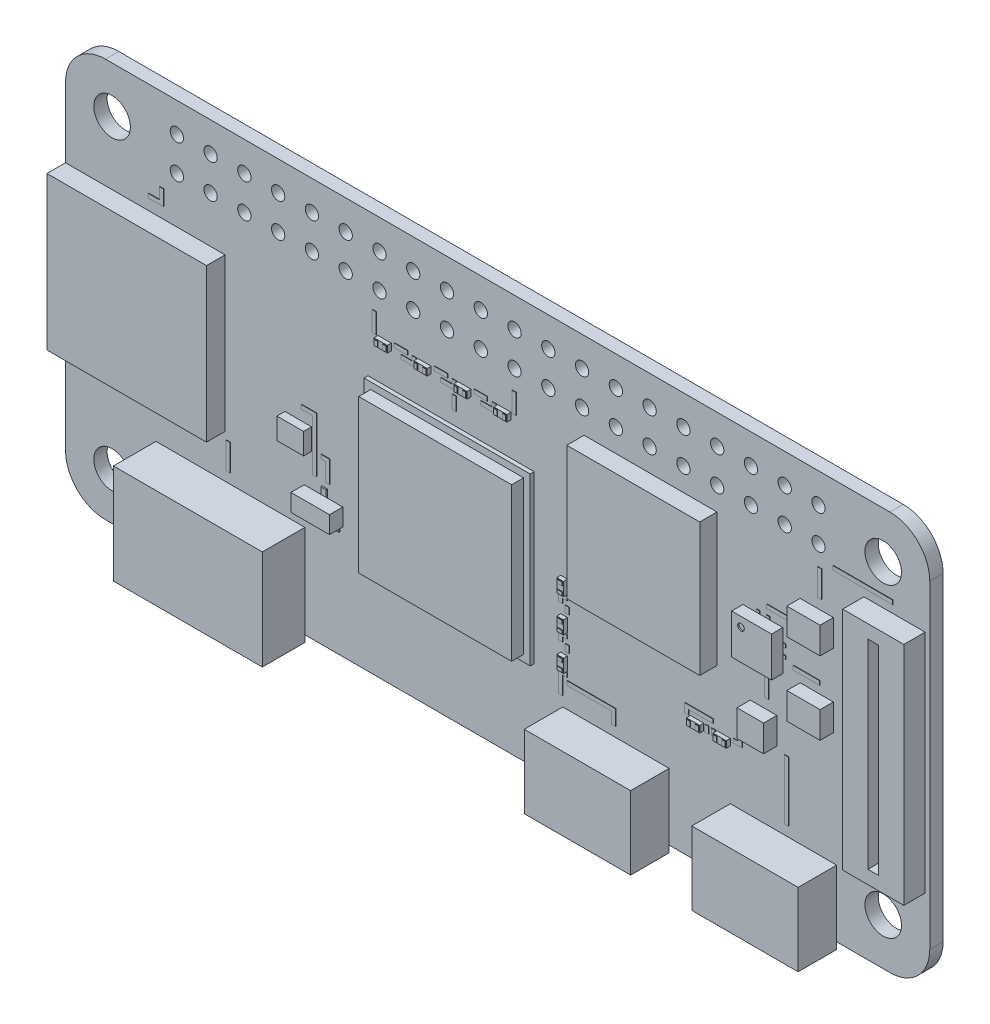
from build123d import *

# Parameters (mm, degrees)
PCB_DEPTH       = 1
SKETCH2_W       = 0.3
SKETCH2_H       = 1
SKETCH2_H_2     = 2
SKETCH2_H_3     = 4.5
SKETCH2_W_2     = 4.5
SKETCH2_H_4     = 0.3
SKETCH2_W_3     = 2
SKETCH2_H_5     = 1.5
SKETCH2_H_6     = 0.5
SKETCH2_W_4     = 0.5
SKETCH2_W_5     = 1
TRACKS_DEPTH    = 0.035
SKETCH3_W       = 0.25
SKETCH3_H       = 0.3
SKETCH3_W_2     = 0.3
SKETCH3_H_2     = 0.25
SMD_ADD00_DEPTH = 0.05
SKETCH4_W       = 0.4
SKETCH4_H       = 0.7
SMD_ADD01_DEPTH = 0.1
SKETCH5_W       = 12.5
SKETCH5_H       = 12.5
SKETCH5_W_2     = 0.5
SKETCH5_H_2     = 1
SKETCH5_W_3     = 1
SKETCH5_H_3     = 0.5
SMD_ADD02_DEPTH = 0.3
SKETCH6_W       = 2
SKETCH6_H       = 1.6
SMD_ADD03_DEPTH = 0.6
SKETCH7_W       = 2.5
SKETCH7_H       = 2
SKETCH7_W_2     = 2
SMD_ADD04_DEPTH = 1
SKETCH8_W       = 10
SKETCH8_H       = 10
SMD_ADD05_DEPTH = 1.3
SKETCH9_W       = 12
SKETCH9_H       = 11.5
SMD_ADD06_DEPTH = 1.4
SKETCH10_W      = 4.6
SKETCH10_H      = 17
SMD_ADD07_DEPTH = 1.6
SKETCH11_W      = 8
SKETCH11_H      = 5.5
SMD_ADD08_DEPTH = 2.9
SKETCH12_W      = 11.2
SKETCH12_H      = 7.5
SMD_ADD09_DEPTH = 3.2
SKETCH13_W      = 3
SKETCH13_H      = 3
SMD_ADD10_DEPTH = 0.85
SKETCH14_W      = 2.9
SKETCH14_H      = 1.3
SMD_ADD11_DEPTH = 1
SKETCH15_W      = 0.4
SKETCH15_H      = 0.25
SKETCH15_W_2    = 0.25
SKETCH15_H_2    = 0.4
SMD_ADD12_DEPTH = 0.05
SKETCH16_W      = 11.5
SKETCH16_H      = 11.5
SMD_ADD13_DEPTH = 0.9
SKETCH17_W      = 5.5
SKETCH17_H      = 2
SMD_CUT00_DEPTH = 7
SKETCH18_R      = 0.25
SMD_CUT01_DEPTH = 0.1
SKETCH19_W      = 0.8
SKETCH19_H      = 15
SMD_CUT02_DEPTH = 1.1
SKETCH20_R      = 1.375
SKETCH20_R_2    = 0.5
HOLES_DEPTH     = 1


with BuildPart() as part:
    # Sketch1 → PCB (new body)
    with BuildSketch(Plane.XY):
        with BuildLine():
            Line((3, 0), (62, 0))
            ThreePointArc((62, 0), (64.121320344, 0.878679656), (65, 3))
            Line((65, 3), (65, 27))
            ThreePointArc((65, 27), (64.121320344, 29.121320344), (62, 30))
            Line((62, 30), (3, 30))
            ThreePointArc((3, 30), (0.878679656, 29.121320344), (0, 27))
            Line((0, 27), (0, 3))
            ThreePointArc((0, 3), (0.878679656, 0.878679656), (3, 0))
        make_face()
    extrude(amount=PCB_DEPTH)

    # Sketch2 → Tracks (add)
    with BuildSketch(Plane.XY.offset(1)):
        with Locations((29.25, 20.75)):
            Rectangle(SKETCH2_W, SKETCH2_H)
        with Locations((12.25, 8.75)):
            Rectangle(SKETCH2_W, SKETCH2_H_2)
        Polygon((41.1, 5.75), (41.1, 6.6), (37.75, 6.6), (37.75, 6.9), (41.4, 6.9), (41.4, 5.75), align=None)
        with Locations((54.25, 8)):
            Rectangle(SKETCH2_W, SKETCH2_H_3)
        Polygon((6.25, 22.9), (7.1, 22.9), (7.1, 23.75), (7.4, 23.75), (7.4, 22.6), (6.25, 22.6), align=None)
        with Locations((60, 24.25)):
            Rectangle(SKETCH2_W_2, SKETCH2_H_4)
        with Locations((53.75, 19.25)):
            Rectangle(SKETCH2_W_3, SKETCH2_H_4)
        with Locations((56.75, 22.75)):
            Rectangle(SKETCH2_W, SKETCH2_H_2)
        with Locations((55.75, 16.25)):
            Rectangle(SKETCH2_W_3, SKETCH2_H_4)
        with Locations((52.75, 14)):
            Rectangle(SKETCH2_W, SKETCH2_H_5)
        Polygon((17.75, 14.9), (18.9, 14.9), (18.9, 10.75), (18.6, 10.75), (18.6, 14.6), (17.75, 14.6), align=None)
        Polygon((19.6, 10.75), (19.6, 12.1), (19.25, 12.1), (19.25, 12.4), (19.9, 12.4), (19.9, 10.75), align=None)
        Polygon((37.75, 7.1), (37.4, 7.1), (37.4, 5.75), (37.1, 5.75), (37.1, 7.4), (37.75, 7.4), align=None)
        with Locations((37.75, 9)):
            Rectangle(SKETCH2_W, SKETCH2_H_6)
        Polygon((37.75, 9.6), (37.4, 9.6), (37.4, 9.25), (37.1, 9.25), (37.1, 9.9), (37.75, 9.9), align=None)
        with Locations((37.75, 11.5)):
            Rectangle(SKETCH2_W, SKETCH2_H_6)
        Polygon((37.75, 12.1), (37.4, 12.1), (37.4, 11.75), (37.1, 11.75), (37.1, 12.4), (37.75, 12.4), align=None)
        with Locations((38, 13.75)):
            Rectangle(SKETCH2_W_4, SKETCH2_H_4)
        Polygon((46.6, 9.25), (46.6, 9.9), (48.75, 9.9), (48.75, 9.6), (46.9, 9.6), (46.9, 9.25), align=None)
        with Locations((48.25, 9)):
            Rectangle(SKETCH2_W, SKETCH2_H_6)
        with Locations((48.75, 9)):
            Rectangle(SKETCH2_W, SKETCH2_H_6)
        Polygon((50.25, 9.4), (50.6, 9.4), (50.6, 10.25), (50.9, 10.25), (50.9, 9.1), (50.25, 9.1), align=None)
        with Locations((23.25, 23)):
            Rectangle(SKETCH2_W, SKETCH2_H_5)
        with Locations((25.25, 22.25)):
            Rectangle(SKETCH2_W_5, SKETCH2_H_4)
        Polygon((26.4, 22.25), (26.4, 21.6), (25.25, 21.6), (25.25, 21.9), (26.1, 21.9), (26.1, 22.25), align=None)
        with Locations((28.25, 22.25)):
            Rectangle(SKETCH2_W_5, SKETCH2_H_4)
        Polygon((29.4, 22.25), (29.4, 21.6), (28.25, 21.6), (28.25, 21.9), (29.1, 21.9), (29.1, 22.25), align=None)
        with Locations((31.25, 22.25)):
            Rectangle(SKETCH2_W_5, SKETCH2_H_4)
        Polygon((32.4, 22.25), (32.4, 21.6), (31.25, 21.6), (31.25, 21.9), (32.1, 21.9), (32.1, 22.25), align=None)
        with Locations((33.75, 23)):
            Rectangle(SKETCH2_W, SKETCH2_H_5)
    extrude(amount=TRACKS_DEPTH)

    # Sketch3 → SMD_add00 (add)
    with BuildSketch(Plane.XY.offset(1)):
        with Locations((52.125, 15.45)):
            Rectangle(SKETCH3_W, SKETCH3_H)
        with Locations((50.95, 16.625)):
            Rectangle(SKETCH3_W_2, SKETCH3_H_2)
        with Locations((52.125, 18.55)):
            Rectangle(SKETCH3_W, SKETCH3_H)
        with Locations((54.05, 16.625)):
            Rectangle(SKETCH3_W_2, SKETCH3_H_2)
        with Locations((52.875, 15.45)):
            Rectangle(SKETCH3_W, SKETCH3_H)
        with Locations((50.95, 17.375)):
            Rectangle(SKETCH3_W_2, SKETCH3_H_2)
        with Locations((52.875, 18.55)):
            Rectangle(SKETCH3_W, SKETCH3_H)
        with Locations((54.05, 17.375)):
            Rectangle(SKETCH3_W_2, SKETCH3_H_2)
    extrude(amount=SMD_ADD00_DEPTH)

    # Sketch4 → SMD_add01 (add)
    with BuildSketch(Plane.XY.offset(1)):
        with Locations((18.55, 8.4)):
            Rectangle(SKETCH4_W, SKETCH4_H)
        with Locations((20.45, 8.4)):
            Rectangle(SKETCH4_W, SKETCH4_H)
        with Locations((19.5, 10)):
            Rectangle(SKETCH4_W, SKETCH4_H)
    extrude(amount=SMD_ADD01_DEPTH)

    # Sketch5 → SMD_add02 (add)
    with BuildSketch(Plane.XY.offset(1)):
        with Locations((29, 13)):
            Rectangle(SKETCH5_W, SKETCH5_H)
        with Locations((37.5, 8)):
            Rectangle(SKETCH5_W_2, SKETCH5_H_2)
        with Locations((37.5, 10.5)):
            Rectangle(SKETCH5_W_2, SKETCH5_H_2)
        with Locations((37.5, 13)):
            Rectangle(SKETCH5_W_2, SKETCH5_H_2)
        with Locations((47.5, 9)):
            Rectangle(SKETCH5_W_3, SKETCH5_H_3)
        with Locations((49.5, 9)):
            Rectangle(SKETCH5_W_3, SKETCH5_H_3)
        with Locations((24, 22)):
            Rectangle(SKETCH5_W_3, SKETCH5_H_3)
        with Locations((27, 22)):
            Rectangle(SKETCH5_W_3, SKETCH5_H_3)
        with Locations((30, 22)):
            Rectangle(SKETCH5_W_3, SKETCH5_H_3)
        with Locations((33, 22)):
            Rectangle(SKETCH5_W_3, SKETCH5_H_3)
    extrude(amount=SMD_ADD02_DEPTH)

    # Sketch6 → SMD_add03 (add)
    with BuildSketch(Plane.XY.offset(1)):
        with Locations((17.5, 13)):
            Rectangle(SKETCH6_W, SKETCH6_H)
    extrude(amount=SMD_ADD03_DEPTH)

    # Sketch7 → SMD_add04 (add)
    with BuildSketch(Plane.XY.offset(1)):
        with Locations((56.5, 20)):
            Rectangle(SKETCH7_W, SKETCH7_H)
        with Locations((56.5, 14.5)):
            Rectangle(SKETCH7_W, SKETCH7_H)
        with Locations((52.5, 11.5)):
            Rectangle(SKETCH7_W_2, SKETCH7_H)
    extrude(amount=SMD_ADD04_DEPTH)

    # Sketch8 → SMD_add05 (add)
    with BuildSketch(Plane.XY.offset(1)):
        with Locations((44, 18.5)):
            Rectangle(SKETCH8_W, SKETCH8_H)
    extrude(amount=SMD_ADD05_DEPTH)

    # Sketch9 → SMD_add06 (add)
    with BuildSketch(Plane.XY.offset(1)):
        with Locations((6, 16)):
            Rectangle(SKETCH9_W, SKETCH9_H)
    extrude(amount=SMD_ADD06_DEPTH)

    # Sketch10 → SMD_add07 (add)
    with BuildSketch(Plane.XY.offset(1)):
        with Locations((62.35, 15)):
            Rectangle(SKETCH10_W, SKETCH10_H)
    extrude(amount=SMD_ADD07_DEPTH)

    # Sketch11 → SMD_add08 (add)
    with BuildSketch(Plane.XY.offset(1)):
        with Locations((41.4, 2.25)):
            Rectangle(SKETCH11_W, SKETCH11_H)
        with Locations((54, 2.25)):
            Rectangle(SKETCH11_W, SKETCH11_H)
    extrude(amount=SMD_ADD08_DEPTH)

    # Sketch12 → SMD_add09 (add)
    with BuildSketch(Plane.XY.offset(1)):
        with Locations((12.4, 3.25)):
            Rectangle(SKETCH12_W, SKETCH12_H)
    extrude(amount=SMD_ADD09_DEPTH)

    # Sketch13 → SMD_add10 (add)
    with BuildSketch(Plane.XY.offset(1.05)):
        with Locations((52.5, 17)):
            Rectangle(SKETCH13_W, SKETCH13_H)
    extrude(amount=SMD_ADD10_DEPTH)

    # Sketch14 → SMD_add11 (add)
    with BuildSketch(Plane.XY.offset(1.1)):
        with Locations((19.5, 9.2)):
            Rectangle(SKETCH14_W, SKETCH14_H)
    extrude(amount=SMD_ADD11_DEPTH)

    # Sketch15 → SMD_add12 (add)
    with BuildSketch(Plane.XY.offset(1.3)):
        with Locations((37.5, 7.675)):
            Rectangle(SKETCH15_W, SKETCH15_H)
        with Locations((37.5, 8.325)):
            Rectangle(SKETCH15_W, SKETCH15_H)
        with Locations((37.5, 10.175)):
            Rectangle(SKETCH15_W, SKETCH15_H)
        with Locations((37.5, 10.825)):
            Rectangle(SKETCH15_W, SKETCH15_H)
        with Locations((37.5, 12.675)):
            Rectangle(SKETCH15_W, SKETCH15_H)
        with Locations((37.5, 13.325)):
            Rectangle(SKETCH15_W, SKETCH15_H)
        with Locations((47.175, 9)):
            Rectangle(SKETCH15_W_2, SKETCH15_H_2)
        with Locations((47.825, 9)):
            Rectangle(SKETCH15_W_2, SKETCH15_H_2)
        with Locations((49.175, 9)):
            Rectangle(SKETCH15_W_2, SKETCH15_H_2)
        with Locations((49.825, 9)):
            Rectangle(SKETCH15_W_2, SKETCH15_H_2)
        with Locations((23.675, 22)):
            Rectangle(SKETCH15_W_2, SKETCH15_H_2)
        with Locations((24.325, 22)):
            Rectangle(SKETCH15_W_2, SKETCH15_H_2)
        with Locations((26.675, 22)):
            Rectangle(SKETCH15_W_2, SKETCH15_H_2)
        with Locations((27.325, 22)):
            Rectangle(SKETCH15_W_2, SKETCH15_H_2)
        with Locations((29.675, 22)):
            Rectangle(SKETCH15_W_2, SKETCH15_H_2)
        with Locations((30.325, 22)):
            Rectangle(SKETCH15_W_2, SKETCH15_H_2)
        with Locations((32.675, 22)):
            Rectangle(SKETCH15_W_2, SKETCH15_H_2)
        with Locations((33.325, 22)):
            Rectangle(SKETCH15_W_2, SKETCH15_H_2)
    extrude(amount=SMD_ADD12_DEPTH)

    # Sketch16 → SMD_add13 (add)
    with BuildSketch(Plane.XY.offset(1.3)):
        with Locations((29, 13)):
            Rectangle(SKETCH16_W, SKETCH16_H)
    extrude(amount=SMD_ADD13_DEPTH)

    # Sketch17 → SMD_cut00 (cut)
    with BuildSketch(Plane(origin=(0, 6.5, 0), x_dir=(1, 0, 0), z_dir=(0, 1, 0))):
        with Locations((12.4, -2.6)):
            Rectangle(SKETCH17_W, SKETCH17_H)
    extrude(amount=-SMD_CUT00_DEPTH, mode=Mode.SUBTRACT)

    # Sketch18 → SMD_cut01 (cut)
    with BuildSketch(Plane.XY.offset(1.9)):
        with Locations((51.7, 17.8)):
            Circle(SKETCH18_R)
    extrude(amount=-SMD_CUT01_DEPTH, mode=Mode.SUBTRACT)

    # Sketch19 → SMD_cut02 (cut)
    with BuildSketch(Plane.XY.offset(2.6)):
        with Locations((62.35, 15)):
            Rectangle(SKETCH19_W, SKETCH19_H)
    extrude(amount=-SMD_CUT02_DEPTH, mode=Mode.SUBTRACT)

    # Sketch20 → Holes (cut)
    with BuildSketch(Plane.XY.offset(1)):
        with Locations((3.5, 3.5)):
            Circle(SKETCH20_R)
        with Locations((61.5, 3.5)):
            Circle(SKETCH20_R)
        with Locations((3.5, 26.5)):
            Circle(SKETCH20_R)
        with Locations((61.5, 26.5)):
            Circle(SKETCH20_R)
        with Locations((8.37, 25.23)):
            Circle(SKETCH20_R_2)
        with Locations((8.37, 27.77)):
            Circle(SKETCH20_R_2)
        with Locations((10.91, 25.23)):
            Circle(SKETCH20_R_2)
        with Locations((10.91, 27.77)):
            Circle(SKETCH20_R_2)
        with Locations((13.45, 25.23)):
            Circle(SKETCH20_R_2)
        with Locations((13.45, 27.77)):
            Circle(SKETCH20_R_2)
        with Locations((15.99, 25.23)):
            Circle(SKETCH20_R_2)
        with Locations((15.99, 27.77)):
            Circle(SKETCH20_R_2)
        with Locations((18.53, 25.23)):
            Circle(SKETCH20_R_2)
        with Locations((18.53, 27.77)):
            Circle(SKETCH20_R_2)
        with Locations((21.07, 25.23)):
            Circle(SKETCH20_R_2)
        with Locations((21.07, 27.77)):
            Circle(SKETCH20_R_2)
        with Locations((23.61, 25.23)):
            Circle(SKETCH20_R_2)
        with Locations((23.61, 27.77)):
            Circle(SKETCH20_R_2)
        with Locations((26.15, 25.23)):
            Circle(SKETCH20_R_2)
        with Locations((26.15, 27.77)):
            Circle(SKETCH20_R_2)
        with Locations((28.69, 25.23)):
            Circle(SKETCH20_R_2)
        with Locations((28.69, 27.77)):
            Circle(SKETCH20_R_2)
        with Locations((31.23, 25.23)):
            Circle(SKETCH20_R_2)
        with Locations((31.23, 27.77)):
            Circle(SKETCH20_R_2)
        with Locations((33.77, 25.23)):
            Circle(SKETCH20_R_2)
        with Locations((33.77, 27.77)):
            Circle(SKETCH20_R_2)
        with Locations((36.31, 25.23)):
            Circle(SKETCH20_R_2)
        with Locations((36.31, 27.77)):
            Circle(SKETCH20_R_2)
        with Locations((38.85, 25.23)):
            Circle(SKETCH20_R_2)
        with Locations((38.85, 27.77)):
            Circle(SKETCH20_R_2)
        with Locations((41.39, 25.23)):
            Circle(SKETCH20_R_2)
        with Locations((41.39, 27.77)):
            Circle(SKETCH20_R_2)
        with Locations((43.93, 25.23)):
            Circle(SKETCH20_R_2)
        with Locations((43.93, 27.77)):
            Circle(SKETCH20_R_2)
        with Locations((46.47, 25.23)):
            Circle(SKETCH20_R_2)
        with Locations((46.47, 27.77)):
            Circle(SKETCH20_R_2)
        with Locations((49.01, 25.23)):
            Circle(SKETCH20_R_2)
        with Locations((49.01, 27.77)):
            Circle(SKETCH20_R_2)
        with Locations((51.55, 25.23)):
            Circle(SKETCH20_R_2)
        with Locations((51.55, 27.77)):
            Circle(SKETCH20_R_2)
        with Locations((54.09, 25.23)):
            Circle(SKETCH20_R_2)
        with Locations((54.09, 27.77)):
            Circle(SKETCH20_R_2)
        with Locations((56.63, 25.23)):
            Circle(SKETCH20_R_2)
        with Locations((56.63, 27.77)):
            Circle(SKETCH20_R_2)
    extrude(amount=-HOLES_DEPTH, mode=Mode.SUBTRACT)


solid = part.part
